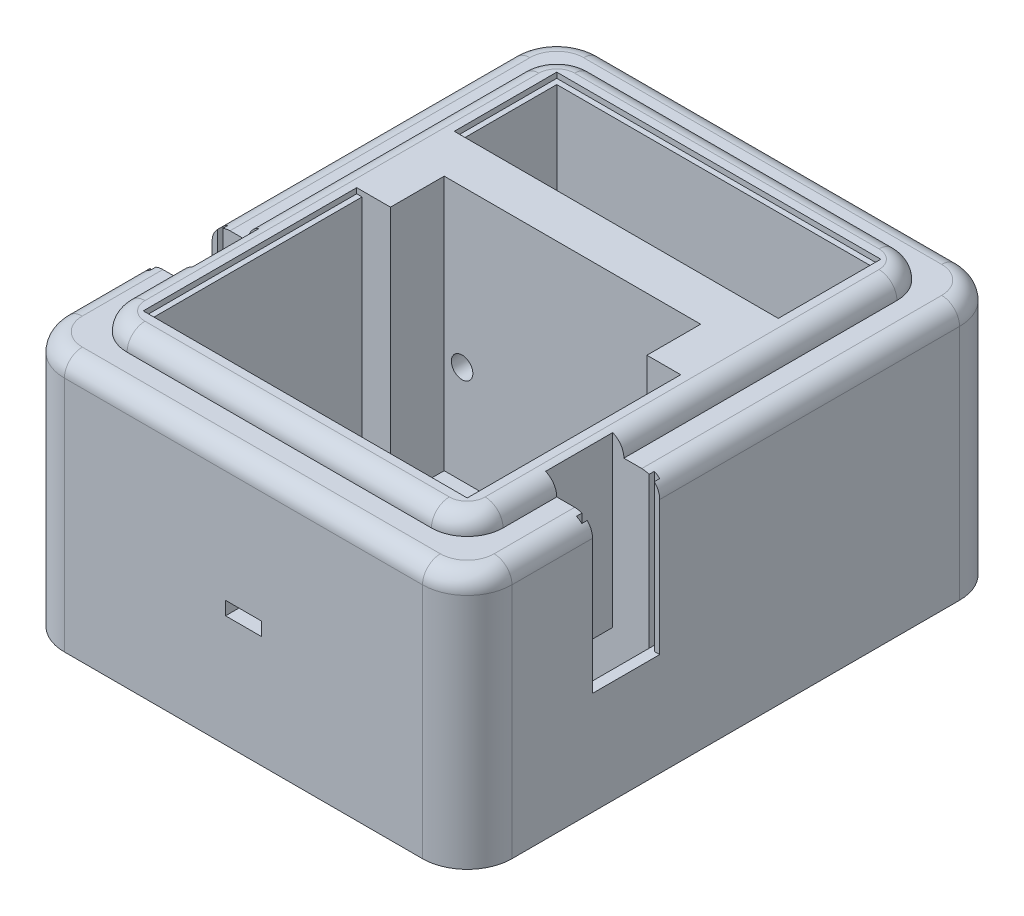
from build123d import *

# Parameters (mm, degrees)
SKICA2_W                  = 100
SKICA2_H                  = 120
P_IDAT_VYSUNUT_M1_DEPTH   = 4
SKICA3_W                  = 15
SKICA3_H                  = 15
SKICA3_W_2                = 70
SKICA3_W_3                = 57.3
SKICA3_H_2                = 3
P_IDAT_VYSUNUT_M2_DEPTH   = 50
SKICA4_W                  = 70
SKICA4_H                  = 20.5
P_IDAT_VYSUNUT_M3_DEPTH   = 23
SKICA8_W                  = 6.35
SKICA8_H                  = 6
ODEBRAT_VYSUNUT_M1_DEPTH  = 23
SKICA9_W                  = 6.35
SKICA9_H                  = 2
P_IDAT_VYSUNUT_M5_DEPTH   = 6
SKICA10_R                 = 2.4
ODEBRAT_VYSUNUT_M2_DEPTH  = 8
SKICA11_W                 = 16.6
SKICA11_H                 = 11.8
ODEBRAT_VYSUNUT_M5_DEPTH  = 10
SKICA14_W                 = 8
SKICA14_H                 = 3
ODEBRAT_VYSUNUT_M6_DEPTH  = 5
SKICA15_W                 = 100
SKICA15_H                 = 120
SKICA15_W_2               = 84
SKICA15_H_2               = 104
ODEBRAT_VYSUNUT_M7_DEPTH  = 4
SKICA20_W                 = 15
SKICA20_H                 = 31
ODEBRAT_VYSUNUT_M8_DEPTH  = 10
SKICA21_W                 = 15
SKICA21_H                 = 31
ODEBRAT_VYSUNUT_M10_DEPTH = 10
SKICA22_R                 = 2.2
ODEBRAT_VYSUNUT_M11_DEPTH = 3
ODEBRAT_START             = -3
SKICA23_R                 = 2.2
ODEBRAT_VYSUNUT_M12_DEPTH = 3
SKICA24_W                 = 1.2
SKICA24_H                 = 1.2
ODEBRAT_VYSUNUT_M14_DEPTH = 27
SKICA26_W                 = 12.6
SKICA26_H                 = 15
ODEBRAT_VYSUNUT_M16_DEPTH = 19
SKICA32_R                 = 2.2
ODEBRAT_VYSUNUT_M19_DEPTH = 158.749801902
SKICA33_W                 = 2
SKICA33_H                 = 6
ODEBRAT_VYSUNUT_M20_DEPTH = 6.35
SKICA35_W                 = 16.6
SKICA35_H                 = 10
ODEBRAT_VYSUNUT_M21_DEPTH = 1.5
SKICA38_W                 = 1
SKICA38_H                 = 23
P_IDAT_VYSUNUT_M9_DEPTH   = 15
SKICA39_W                 = 5.35
SKICA39_H                 = 5
ODEBRAT_VYSUNUT_M23_DEPTH = 23
SKICA40_W                 = 15
SKICA40_H                 = 31
ODEBRAT_VYSUNUT_M24_DEPTH = 0.5
SKICA41_W                 = 15
SKICA41_H                 = 31
ODEBRAT_VYSUNUT_M25_DEPTH = 0.5
SKICA43_W                 = 70
SKICA43_H                 = 20.5
P_IDAT_VYSUNUT_M10_DEPTH  = 7
P_IDAT_VYSUNUT_M11_DEPTH  = 7
SKICA45_W                 = 70
SKICA45_H                 = 1.2
SKICA45_H_2               = 20.5
SKICA45_W_2               = 1.2
SKICA45_H_3               = 46.5
ODEBRAT_VYSUNUT_M26_DEPTH = 1.2
ZAOBLIT1_R                = 10
ZAOBLIT2_R                = 8
ZAOBLIT3_R                = 4
SKICA47_R                 = 2.4
P_IDAT_VYSUNUT_M13_DEPTH  = 7
SKICA47_3_R               = 2.4
ODEBRAT_VYSUNUT_M27_DEPTH = 7


with BuildPart() as part:
    # Skica2 → Přidat vysunutím1 (new body)
    with BuildSketch(Plane(origin=(0, 0, 0), x_dir=(1, 0, 0), z_dir=(0, 1, 0))):
        with Locations((50, 60)):
            Rectangle(SKICA2_W, SKICA2_H)
    extrude(amount=P_IDAT_VYSUNUT_M1_DEPTH)

    # Skica3 → Přidat vysunutím2 (add)
    with BuildSketch(Plane(origin=(0, 4, 0), x_dir=(1, 0, 0), z_dir=(0, 1, 0))):
        with Locations((7.5, 112.5)):
            Rectangle(SKICA3_W, SKICA3_H)
        with Locations((50, 112.5)):
            Rectangle(SKICA3_W_2, SKICA3_H)
        Polygon((15, 105), (0, 105), (0, 15), (15, 15), (15, 61.5), (15, 76.5), (15, 84.5), align=None)
        with Locations((92.5, 112.5)):
            Rectangle(SKICA3_W, SKICA3_H)
        Polygon((100, 105), (85, 105), (85, 84.5), (85, 76.5), (85, 61.5), (85, 15), (100, 15), align=None)
        Polygon((85, 84.5), (15, 84.5), (15, 76.5), (21.35, 76.5), (78.65, 76.5), (85, 76.5), align=None)
        with Locations((7.5, 7.5)):
            Rectangle(SKICA3_W, SKICA3_H)
        with Locations((50, 7.5)):
            Rectangle(SKICA3_W_2, SKICA3_H)
        with Locations((92.5, 7.5)):
            Rectangle(SKICA3_W, SKICA3_H)
        Polygon((21.35, 76.5), (15, 76.5), (15, 61.5), (21.35, 61.5), (21.35, 73.5), align=None)
        with Locations((50, 75)):
            Rectangle(SKICA3_W_3, SKICA3_H_2)
        Polygon((85, 61.5), (85, 76.5), (78.65, 76.5), (78.65, 73.5), (78.65, 61.5), align=None)
    extrude(amount=P_IDAT_VYSUNUT_M2_DEPTH)

    # Skica4 → Přidat vysunutím3 (add)
    with BuildSketch(Plane(origin=(0, 4, 0), x_dir=(1, 0, 0), z_dir=(0, 1, 0))):
        with Locations((50, 94.75)):
            Rectangle(SKICA4_W, SKICA4_H)
    extrude(amount=P_IDAT_VYSUNUT_M3_DEPTH)

    # Skica8 → Odebrat vysunutím1 (cut)
    with BuildSketch(Plane.XY.offset(-61.5)):
        with Locations((81.825, 30)):
            Rectangle(SKICA8_W, SKICA8_H)
    extrude(amount=-ODEBRAT_VYSUNUT_M1_DEPTH, mode=Mode.SUBTRACT)

    # Skica9 → Přidat vysunutím5 (add)
    with BuildSketch(Plane(origin=(0, 27, 0), x_dir=(1, 0, 0), z_dir=(0, 1, 0))):
        with Locations((81.825, 62.5)):
            Rectangle(SKICA9_W, SKICA9_H)
    extrude(amount=P_IDAT_VYSUNUT_M5_DEPTH)

    # Skica10 → Odebrat vysunutím2 (cut)
    with BuildSketch(Plane.XY.offset(-73.5)):
        with Locations((25.35, 19)):
            Circle(SKICA10_R)
        with Locations((74.65, 19)):
            Circle(SKICA10_R)
    extrude(amount=-ODEBRAT_VYSUNUT_M2_DEPTH, mode=Mode.SUBTRACT)

    # Skica11 → Odebrat vysunutím5 (cut)
    with BuildSketch(Plane(origin=(0, 0, -15), x_dir=(-1, 0, 0), z_dir=(0, 0, -1))):
        with Locations((-50, 24.9)):
            Rectangle(SKICA11_W, SKICA11_H)
    extrude(amount=-ODEBRAT_VYSUNUT_M5_DEPTH, mode=Mode.SUBTRACT)

    # Skica14 → Odebrat vysunutím6 (cut)
    with BuildSketch(Plane.XY):
        with Locations((50, 26.5)):
            Rectangle(SKICA14_W, SKICA14_H)
    extrude(amount=-ODEBRAT_VYSUNUT_M6_DEPTH, mode=Mode.SUBTRACT)

    # Skica15 → Odebrat vysunutím7 (cut)
    with BuildSketch(Plane(origin=(0, 54, 0), x_dir=(1, 0, 0), z_dir=(0, 1, 0))):
        with Locations((50, 60)):
            Rectangle(SKICA15_W, SKICA15_H)
        with Locations((50, 60)):
            Rectangle(SKICA15_W_2, SKICA15_H_2, mode=Mode.SUBTRACT)
    extrude(amount=-ODEBRAT_VYSUNUT_M7_DEPTH, mode=Mode.SUBTRACT)

    # Skica20 → Odebrat vysunutím8 (cut)
    with BuildSketch(Plane.ZY):
        with Locations((-35.5, 38.5)):
            Rectangle(SKICA20_W, SKICA20_H)
    extrude(amount=-ODEBRAT_VYSUNUT_M8_DEPTH, mode=Mode.SUBTRACT)

    # Skica21 → Odebrat vysunutím10 (cut)
    with BuildSketch(Plane(origin=(100, 0, 0), x_dir=(0, 0, -1), z_dir=(1, 0, 0))):
        with Locations((35.5, 38.5)):
            Rectangle(SKICA21_W, SKICA21_H)
    extrude(amount=-ODEBRAT_VYSUNUT_M10_DEPTH, mode=Mode.SUBTRACT)

    # Skica22 → Odebrat vysunutím11 (cut)
    with BuildSketch(Plane.ZY.offset(-10)):
        with Locations((-35.5, 31.3)):
            Circle(SKICA22_R)
    extrude(amount=-ODEBRAT_VYSUNUT_M11_DEPTH, mode=Mode.SUBTRACT)

    # Skica23 → Odebrat vysunutím12 (cut)
    with BuildSketch(Plane(origin=(90, 0, 0), x_dir=(0, 0, -1), z_dir=(1, 0, 0)).offset(ODEBRAT_START)):
        with Locations(Location((35.5, 31.3, 0), (0, 0, 180))):
            Circle(SKICA23_R)
    extrude(amount=ODEBRAT_VYSUNUT_M12_DEPTH, mode=Mode.SUBTRACT)

    # Skica24 → Odebrat vysunutím14 (cut)
    with BuildSketch(Plane(origin=(0, 50, 0), x_dir=(1, 0, 0), z_dir=(0, 1, 0))):
        with Locations((1.8, 27.4)):
            Rectangle(SKICA24_W, SKICA24_H)
        with Locations((1.8, 43.6)):
            Rectangle(SKICA24_W, SKICA24_H)
        with Locations((98.2, 27.4)):
            Rectangle(SKICA24_W, SKICA24_H)
        with Locations((98.2, 43.6)):
            Rectangle(SKICA24_W, SKICA24_H)
    extrude(amount=-ODEBRAT_VYSUNUT_M14_DEPTH, mode=Mode.SUBTRACT)

    # Skica26 → Odebrat vysunutím16 (cut)
    with BuildSketch(Plane(origin=(0, 23, 0), x_dir=(1, 0, 0), z_dir=(0, 1, 0))):
        with Locations((8.7, 35.5)):
            Rectangle(SKICA26_W, SKICA26_H)
        with Locations((91.3, 35.5)):
            Rectangle(SKICA26_W, SKICA26_H)
    extrude(amount=-ODEBRAT_VYSUNUT_M16_DEPTH, mode=Mode.SUBTRACT)

    # Skica32 → Odebrat vysunutím19 (cut, through all)
    with BuildSketch(Plane.ZY.offset(-13)):
        with Locations((-35.5, 31.3)):
            Circle(SKICA32_R)
    extrude(amount=-ODEBRAT_VYSUNUT_M19_DEPTH, mode=Mode.SUBTRACT)

    # Skica33 → Odebrat vysunutím20 (cut)
    with BuildSketch(Plane.ZY.offset(-78.65)):
        with Locations((-62.5, 30)):
            Rectangle(SKICA33_W, SKICA33_H)
    extrude(amount=-ODEBRAT_VYSUNUT_M20_DEPTH, mode=Mode.SUBTRACT)

    # Skica35 → Odebrat vysunutím21 (cut)
    with BuildSketch(Plane(origin=(0, 19, 0), x_dir=(1, 0, 0), z_dir=(0, 1, 0))):
        with Locations((50, 10)):
            Rectangle(SKICA35_W, SKICA35_H)
    extrude(amount=-ODEBRAT_VYSUNUT_M21_DEPTH, mode=Mode.SUBTRACT)

    # Skica38 → Přidat vysunutím9 (add)
    with BuildSketch(Plane(origin=(0, 27, 0), x_dir=(1, 0, 0), z_dir=(0, 1, 0))):
        with Locations((79.15, 73)):
            Rectangle(SKICA38_W, SKICA38_H)
    extrude(amount=P_IDAT_VYSUNUT_M9_DEPTH)

    # Skica39 → Odebrat vysunutím23 (cut)
    with BuildSketch(Plane.XY.offset(-61.5)):
        with Locations((82.325, 35.5)):
            Rectangle(SKICA39_W, SKICA39_H)
    extrude(amount=-ODEBRAT_VYSUNUT_M23_DEPTH, mode=Mode.SUBTRACT)

    # Skica40 → Odebrat vysunutím24 (cut)
    with BuildSketch(Plane.ZY.offset(-10)):
        with Locations((-35.5, 38.5)):
            Rectangle(SKICA40_W, SKICA40_H)
    extrude(amount=-ODEBRAT_VYSUNUT_M24_DEPTH, mode=Mode.SUBTRACT)

    # Skica41 → Odebrat vysunutím25 (cut)
    with BuildSketch(Plane(origin=(90, 0, 0), x_dir=(0, 0, -1), z_dir=(1, 0, 0))):
        with Locations((35.5, 38.5)):
            Rectangle(SKICA41_W, SKICA41_H)
    extrude(amount=-ODEBRAT_VYSUNUT_M25_DEPTH, mode=Mode.SUBTRACT)

    # Skica43 → Přidat vysunutím10 (add)
    with BuildSketch(Plane(origin=(0, 54, 0), x_dir=(1, 0, 0), z_dir=(0, 1, 0))):
        Polygon((92, 8), (92, 28), (89.5, 28), (89.5, 43), (92, 43), (92, 112), (8, 112), (8, 43), (10.5, 43), (10.5, 28), (8, 28), (8, 8), align=None)
        with Locations((50, 94.75)):
            Rectangle(SKICA43_W, SKICA43_H, mode=Mode.SUBTRACT)
        Polygon((78.65, 73.5), (78.65, 61.5), (85, 61.5), (85, 15), (15, 15), (15, 61.5), (21.35, 61.5), (21.35, 73.5), align=None, mode=Mode.SUBTRACT)
    extrude(amount=P_IDAT_VYSUNUT_M10_DEPTH)

    # Skica44 → Přidat vysunutím11 (add)
    with BuildSketch(Plane(origin=(0, 50, 0), x_dir=(1, 0, 0), z_dir=(0, 1, 0))):
        Polygon((0, 120), (0, 43), (1.2, 43), (1.2, 44.2), (2.4, 44.2), (2.4, 43), (8, 43), (8, 112), (92, 112), (92, 43), (97.6, 43), (97.6, 44.2), (98.8, 44.2), (98.8, 43), (100, 43), (100, 120), align=None)
        Polygon((1.2, 28), (0, 28), (0, 0), (100, 0), (100, 28), (98.8, 28), (98.8, 26.8), (97.6, 26.8), (97.6, 28), (92, 28), (92, 8), (8, 8), (8, 28), (2.4, 28), (2.4, 26.8), (1.2, 26.8), align=None)
    extrude(amount=P_IDAT_VYSUNUT_M11_DEPTH)

    # Skica45 → Odebrat vysunutím26 (cut)
    with BuildSketch(Plane(origin=(0, 61, 0), x_dir=(1, 0, 0), z_dir=(0, 1, 0))):
        with Locations((50, 105.6)):
            Rectangle(SKICA45_W, SKICA45_H)
        Polygon((15, 84.5), (15, 105), (15, 106.2), (13.8, 106.2), (13.8, 84.5), align=None)
        with Locations((50, 94.75)):
            Rectangle(SKICA45_W, SKICA45_H_2)
        Polygon((85, 106.2), (85, 105), (85, 84.5), (85, 83.3), (86.2, 83.3), (86.2, 106.2), align=None)
        Polygon((85, 84.5), (15, 84.5), (13.8, 84.5), (13.8, 83.3), (85, 83.3), align=None)
        Polygon((85, 15), (15, 15), (13.8, 15), (13.8, 13.8), (85, 13.8), align=None)
        with Locations((14.4, 38.25)):
            Rectangle(SKICA45_W_2, SKICA45_H_3)
        Polygon((85, 61.5), (85, 15), (85, 13.8), (86.2, 13.8), (86.2, 61.5), align=None)
    extrude(amount=-ODEBRAT_VYSUNUT_M26_DEPTH, mode=Mode.SUBTRACT)

    # Zaoblit1
    zaoblit1_edges = [part.edges().sort_by_distance(p)[0] for p in [
        (0, 28.5, -120),
        (100, 28.5, -120),
        (100, 28.5, 0),
        (0, 28.5, 0),
    ]]
    fillet(zaoblit1_edges, radius=ZAOBLIT1_R)

    # Zaoblit2
    zaoblit2_edges = [part.edges().sort_by_distance(p)[0] for p in [
        (92, 59, -8),
        (8, 59, -8),
        (8, 59, -112),
        (92, 59, -112),
    ]]
    fillet(zaoblit2_edges, radius=ZAOBLIT2_R)

    # Zaoblit3
    # the kernel refuses this fillet: 4 mm, written as the material it takes off along each edge
    with BuildSketch(Plane(origin=(8, 61, -104), x_dir=(1, 0, 0), z_dir=(0, 0, 1)), Plane(origin=(92, 61, -33), x_dir=(-1, 0, 0), z_dir=(0, 0, -1))) as zaoblit3_piece_1:
        with BuildLine():
            CenterArc((ZAOBLIT3_R, -ZAOBLIT3_R), ZAOBLIT3_R, 90, 90)
            Line((0, -ZAOBLIT3_R), (0, 0))
            Line((0, 0), (ZAOBLIT3_R, 0))
        make_face()
    extrude(amount=71, mode=Mode.SUBTRACT)
    with BuildSketch(Plane(origin=(100, 57, -10), x_dir=(-1, 0, 0), z_dir=(0, 0, -1)), Plane(origin=(0, 57, -38), x_dir=(1, 0, 0), z_dir=(0, 0, 1))) as zaoblit3_piece_2:
        with BuildLine():
            CenterArc((ZAOBLIT3_R, -ZAOBLIT3_R), ZAOBLIT3_R, 90, 90)
            Line((0, -ZAOBLIT3_R), (0, 0))
            Line((0, 0), (ZAOBLIT3_R, 0))
        make_face()
    extrude(amount=28, mode=Mode.SUBTRACT)
    with BuildSketch(Plane(origin=(100, 57, -33), x_dir=(0, -1, 0), z_dir=(0, 0, -1)), Plane(origin=(0, 57, -110), x_dir=(0, -1, 0), z_dir=(0, 0, 1))) as zaoblit3_piece_3:
        with BuildLine():
            CenterArc((ZAOBLIT3_R, ZAOBLIT3_R), ZAOBLIT3_R, 180, 90)
            Line((0, ZAOBLIT3_R), (0, 0))
            Line((0, 0), (ZAOBLIT3_R, 0))
        make_face()
    extrude(amount=77, mode=Mode.SUBTRACT)
    with BuildSketch(Plane(origin=(10, 57, 0), x_dir=(0, 0, -1), z_dir=(1, 0, 0)), Plane(origin=(90, 57, -120), x_dir=(0, 0, 1), z_dir=(-1, 0, 0))) as zaoblit3_piece_4:
        with BuildLine():
            CenterArc((ZAOBLIT3_R, -ZAOBLIT3_R), ZAOBLIT3_R, 90, 90)
            Line((0, -ZAOBLIT3_R), (0, 0))
            Line((0, 0), (ZAOBLIT3_R, 0))
        make_face()
    extrude(amount=80, mode=Mode.SUBTRACT)
    with BuildSketch(Plane(origin=(10, 57, -10), x_dir=(0, 0, 1), z_dir=(1, 0, 0))) as zaoblit3_piece_5:
        with BuildLine():
            CenterArc((10 - ZAOBLIT3_R, ZAOBLIT3_R), ZAOBLIT3_R, 270, 90)
            Line((10, ZAOBLIT3_R), (10, 0))
            Line((10, 0), (10 - ZAOBLIT3_R, 0))
        make_face()
    revolve(axis=Axis((10, 57, -10), (0, -1, 0)), revolution_arc=90, mode=Mode.SUBTRACT)
    with BuildSketch(Plane(origin=(90, 57, -10), x_dir=(0, 0, 1), z_dir=(-1, 0, 0))) as zaoblit3_piece_6:
        with BuildLine():
            CenterArc((10 - ZAOBLIT3_R, -ZAOBLIT3_R), ZAOBLIT3_R, 0, 90)
            Line((10, -ZAOBLIT3_R), (10, 0))
            Line((10, 0), (10 - ZAOBLIT3_R, 0))
        make_face()
    revolve(axis=Axis((90, 57, -10), (0, 1, 0)), revolution_arc=90, mode=Mode.SUBTRACT)
    with BuildSketch(Plane(origin=(10, 57, -110), x_dir=(0, 0, -1), z_dir=(1, 0, 0))) as zaoblit3_piece_7:
        with BuildLine():
            CenterArc((10 - ZAOBLIT3_R, -ZAOBLIT3_R), ZAOBLIT3_R, 0, 90)
            Line((10, -ZAOBLIT3_R), (10, 0))
            Line((10, 0), (10 - ZAOBLIT3_R, 0))
        make_face()
    revolve(axis=Axis((10, 57, -110), (0, 1, 0)), revolution_arc=90, mode=Mode.SUBTRACT)
    with BuildSketch(Plane(origin=(90, 57, -110), x_dir=(0, 0, -1), z_dir=(-1, 0, 0))) as zaoblit3_piece_8:
        with BuildLine():
            CenterArc((10 - ZAOBLIT3_R, ZAOBLIT3_R), ZAOBLIT3_R, 270, 90)
            Line((10, ZAOBLIT3_R), (10, 0))
            Line((10, 0), (10 - ZAOBLIT3_R, 0))
        make_face()
    revolve(axis=Axis((90, 57, -110), (0, -1, 0)), revolution_arc=90, mode=Mode.SUBTRACT)
    with BuildSketch(Plane(origin=(16, 61, -8), x_dir=(0, -1, 0), z_dir=(1, 0, 0))) as zaoblit3_piece_9:
        with BuildLine():
            CenterArc((ZAOBLIT3_R, ZAOBLIT3_R), ZAOBLIT3_R, 180, 90)
            Line((0, ZAOBLIT3_R), (0, 0))
            Line((0, 0), (ZAOBLIT3_R, 0))
        make_face()
    extrude(amount=68, mode=Mode.SUBTRACT)
    with BuildSketch(Plane(origin=(84, 61, -112), x_dir=(0, 0, 1), z_dir=(-1, 0, 0))) as zaoblit3_piece_10:
        with BuildLine():
            CenterArc((ZAOBLIT3_R, -ZAOBLIT3_R), ZAOBLIT3_R, 90, 90)
            Line((0, -ZAOBLIT3_R), (0, 0))
            Line((0, 0), (ZAOBLIT3_R, 0))
        make_face()
    extrude(amount=68, mode=Mode.SUBTRACT)
    with BuildSketch(Plane(origin=(84, 61, -16), x_dir=(0, 0, 1), z_dir=(-1, 0, 0))) as zaoblit3_piece_11:
        with BuildLine():
            CenterArc((8 - ZAOBLIT3_R, -ZAOBLIT3_R), ZAOBLIT3_R, 0, 90)
            Line((8 - ZAOBLIT3_R, 0), (8, 0))
            Line((8, 0), (8, -ZAOBLIT3_R))
        make_face()
    revolve(axis=Axis((84, 61, -16), (0, 1, 0)), revolution_arc=90, mode=Mode.SUBTRACT)
    with BuildSketch(Plane(origin=(84, 61, -104), x_dir=(0, 0, -1), z_dir=(-1, 0, 0))) as zaoblit3_piece_12:
        with BuildLine():
            CenterArc((8 - ZAOBLIT3_R, ZAOBLIT3_R), ZAOBLIT3_R, 270, 90)
            Line((8, ZAOBLIT3_R), (8, 0))
            Line((8, 0), (8 - ZAOBLIT3_R, 0))
        make_face()
    revolve(axis=Axis((84, 61, -104), (0, -1, 0)), revolution_arc=90, mode=Mode.SUBTRACT)
    with BuildSketch(Plane(origin=(16, 61, -104), x_dir=(-1, 0, 0), z_dir=(0, 0, 1))) as zaoblit3_piece_13:
        with BuildLine():
            CenterArc((8 - ZAOBLIT3_R, ZAOBLIT3_R), ZAOBLIT3_R, 270, 90)
            Line((8, ZAOBLIT3_R), (8, 0))
            Line((8, 0), (8 - ZAOBLIT3_R, 0))
        make_face()
    revolve(axis=Axis((16, 61, -104), (0, -1, 0)), revolution_arc=90, mode=Mode.SUBTRACT)
    with BuildSketch(Plane(origin=(16, 61, -16), x_dir=(-1, 0, 0), z_dir=(0, 0, -1))) as zaoblit3_piece_14:
        with BuildLine():
            CenterArc((8 - ZAOBLIT3_R, -ZAOBLIT3_R), ZAOBLIT3_R, 0, 90)
            Line((8 - ZAOBLIT3_R, 0), (8, 0))
            Line((8, 0), (8, -ZAOBLIT3_R))
        make_face()
    revolve(axis=Axis((16, 61, -16), (0, 1, 0)), revolution_arc=90, mode=Mode.SUBTRACT)
    with BuildSketch(Plane(origin=(8, 61, -38), x_dir=(0, -1, 0), z_dir=(0, 0, 1)), Plane(origin=(92, 61, -16), x_dir=(0, -1, 0), z_dir=(0, 0, -1))) as zaoblit3_piece_15:
        with BuildLine():
            CenterArc((ZAOBLIT3_R, ZAOBLIT3_R), ZAOBLIT3_R, 180, 90)
            Line((0, ZAOBLIT3_R), (0, 0))
            Line((0, 0), (ZAOBLIT3_R, 0))
        make_face()
    extrude(amount=22, mode=Mode.SUBTRACT)

    # Skica47 → Přidat vysunutím13 (add)
    with BuildSketch(Plane.XY.offset(-73.5)):
        with Locations((25.35, 19)):
            Circle(SKICA47_R)
        with Locations((74.65, 19)):
            Circle(SKICA47_R)
    extrude(amount=-P_IDAT_VYSUNUT_M13_DEPTH)

    # Skica47<3> → Odebrat vysunutím27 (cut)
    with BuildSketch(Plane.XY.offset(-73.5)):
        with Locations((25.35, 26)):
            Circle(SKICA47_3_R)
        with Locations((74.65, 26)):
            Circle(SKICA47_3_R)
    extrude(amount=-ODEBRAT_VYSUNUT_M27_DEPTH, mode=Mode.SUBTRACT)


solid = part.part
